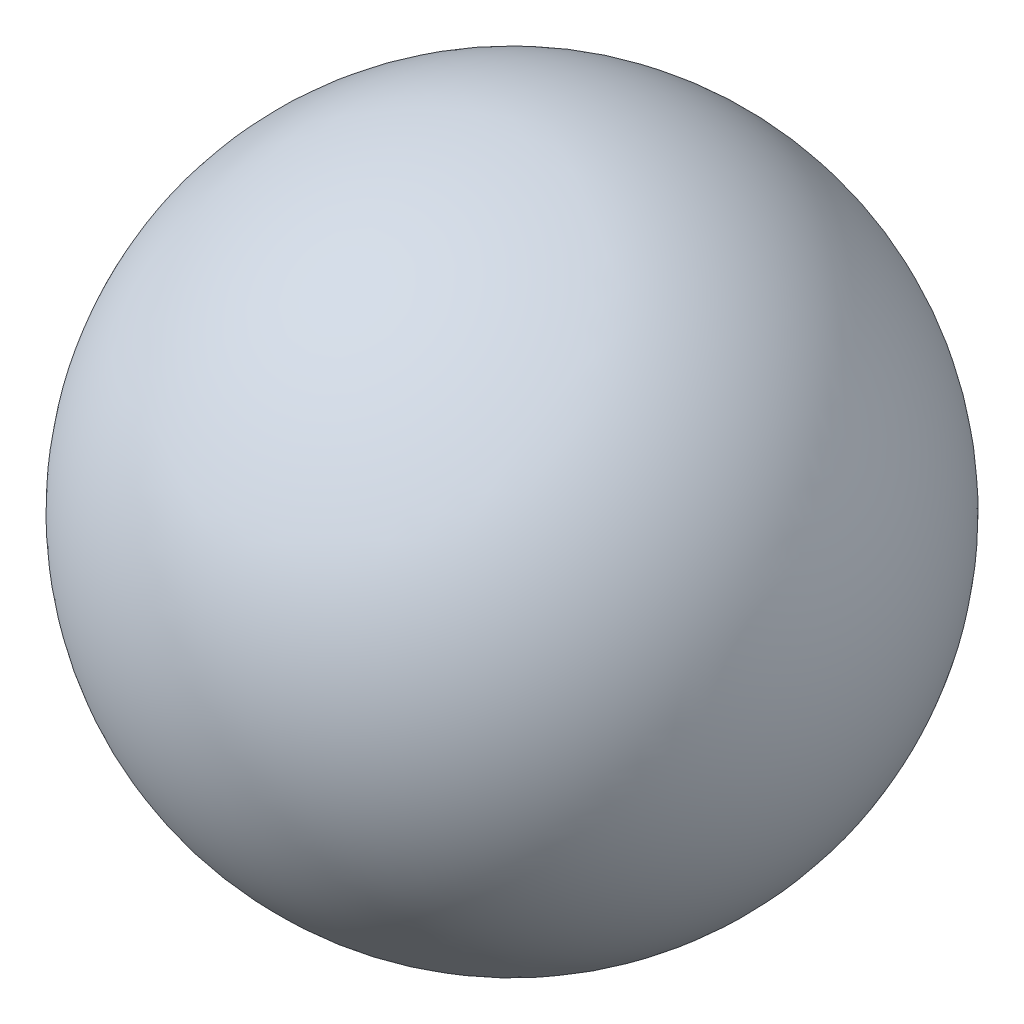
from build123d import *


with BuildPart() as part:
    # 草图1 → 旋转3 (revolve)
    with BuildSketch(Plane(origin=(0, 0, 0), x_dir=(1, 0, 0), z_dir=(0, 1, 0))):
        with BuildLine():
            Line((2.5, 0), (-2.5, 0))
            ThreePointArc((-2.5, 0), (0, -2.5), (2.5, 0))
        make_face()
    revolve(axis=Axis((-2.5, 0, 0), (1, 0, 0)))


solid = part.part
